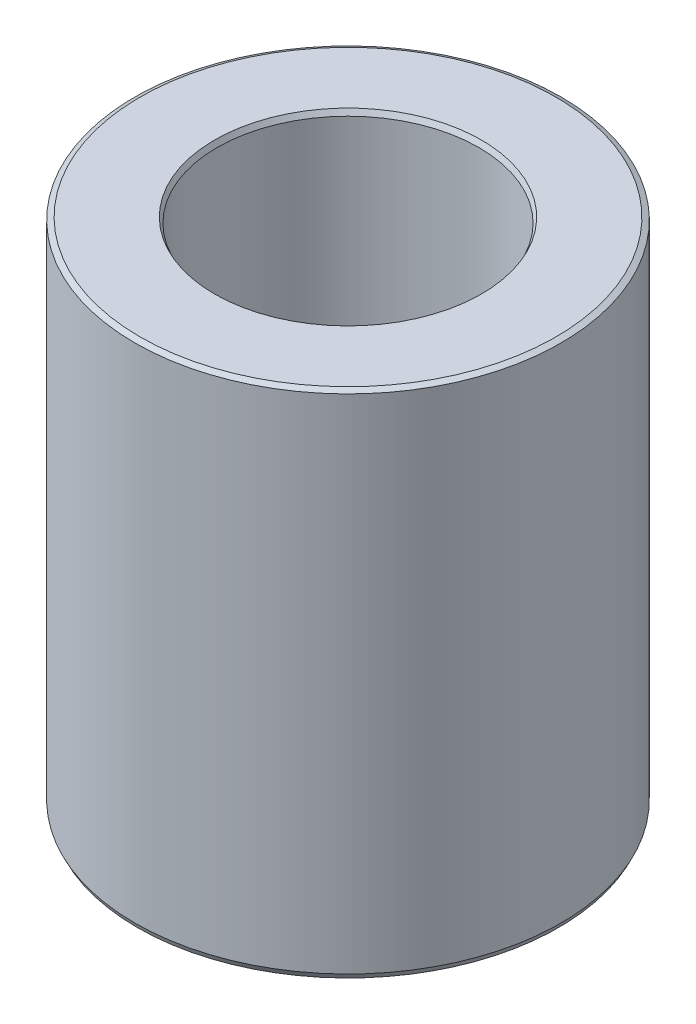
from build123d import *
from OCP.BRepFilletAPI import BRepFilletAPI_MakeChamfer

# Parameters (mm, degrees)
SKETCH1_R           = 60
BOSS_EXTRUDE1_DEPTH = 143.663507821
SKETCH2_R           = 36.856622119
CUT_EXTRUDE1_DEPTH  = 167.85084201
CHAMFER1_SIZE       = 0.717276039
CHAMFER1_SIZE2      = 1.478780637


with BuildPart() as part:
    # Sketch1 → Boss-Extrude1 (new body)
    with BuildSketch(Plane(origin=(0, 0, 0), x_dir=(1, 0, 0), z_dir=(0, 1, 0))):
        Circle(SKETCH1_R)
    extrude(amount=BOSS_EXTRUDE1_DEPTH)

    # Sketch2 → Cut-Extrude1 (cut, through all)
    with BuildSketch(Plane(origin=(0, 0, 0), x_dir=(1, 0, 0), z_dir=(0, 1, 0))):
        Circle(SKETCH2_R)
    extrude(amount=CUT_EXTRUDE1_DEPTH, mode=Mode.SUBTRACT)

    # Chamfer1: one chamfer whose edges measure the first distance from different faces: ONE call of the kernel's chamfer builder (chamfer() names one face for all edges)
    chamfer1_edges_1 = [part.edges().sort_by_distance(p)[0] for p in [
        (-36.856622119, 143.663507821, 0),
    ]]
    chamfer1_side_1 = [part.faces().sort_by_distance(p)[0] for p in [
        (-58.302943725, 143.663507821, 0),
    ]]
    chamfer1_edges_2 = [part.edges().sort_by_distance(p)[0] for p in [
        (-36.856622119, 0, 0),
    ]]
    chamfer1_side_2 = [part.faces().sort_by_distance(p)[0] for p in [
        (-36.856622119, 71.83175391, 0),
    ]]
    chamfer1_edges_3 = [part.edges().sort_by_distance(p)[0] for p in [
        (-60, 0, 0),
    ]]
    chamfer1_side_3 = [part.faces().sort_by_distance(p)[0] for p in [
        (-58.302943725, 0, 0),
    ]]
    chamfer1_edges_4 = [part.edges().sort_by_distance(p)[0] for p in [
        (-60, 143.663507821, 0),
    ]]
    chamfer1_side_4 = [part.faces().sort_by_distance(p)[0] for p in [
        (-60, 71.83175391, 0),
    ]]
    chamfer1 = BRepFilletAPI_MakeChamfer(part.part.solid().wrapped)
    for e in chamfer1_edges_1:
        chamfer1.Add(CHAMFER1_SIZE, CHAMFER1_SIZE2, e.wrapped, chamfer1_side_1[0].wrapped)  # the first distance lies on this face
    for e in chamfer1_edges_2:
        chamfer1.Add(CHAMFER1_SIZE, CHAMFER1_SIZE2, e.wrapped, chamfer1_side_2[0].wrapped)  # the first distance lies on this face
    for e in chamfer1_edges_3:
        chamfer1.Add(CHAMFER1_SIZE, CHAMFER1_SIZE2, e.wrapped, chamfer1_side_3[0].wrapped)  # the first distance lies on this face
    for e in chamfer1_edges_4:
        chamfer1.Add(CHAMFER1_SIZE, CHAMFER1_SIZE2, e.wrapped, chamfer1_side_4[0].wrapped)  # the first distance lies on this face
    add(Compound.cast(chamfer1.Shape()), mode=Mode.REPLACE)


solid = part.part
